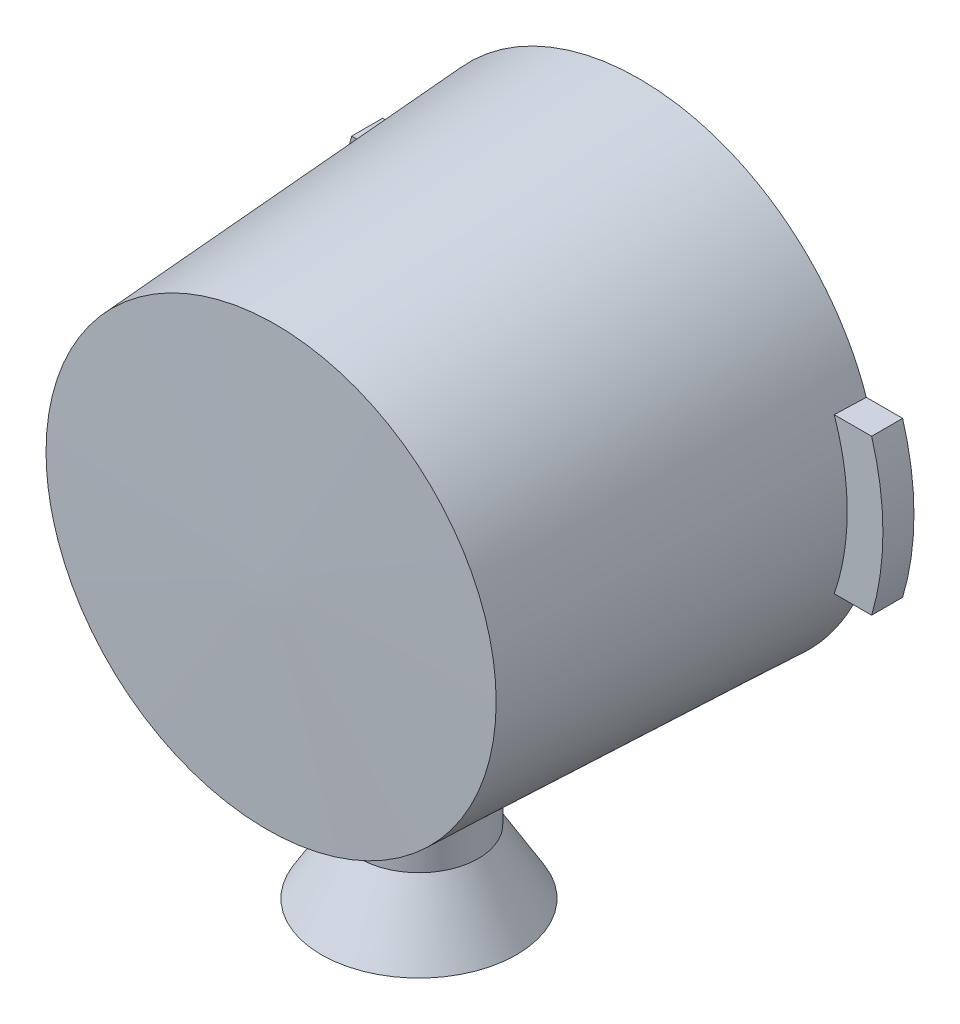
from build123d import *

# Parameters (mm, degrees)
BOSS_EXTRUDE9_DEPTH = 5
SKETCH10_W          = 100.017630752
SKETCH10_H          = 82.257490713
CUT_EXTRUDE5_DEPTH  = 5


with BuildPart() as part:
    # Sketch3 → Revolve4 (revolve)
    with BuildSketch(Plane.XY):
        Polygon((-45.345396491, 59.752657492), (-50.285549319, 51.471259135), (-37.687875269, 51.471259135), (-37.687875269, 71.31273478), (-45.345396491, 71.31273478), align=None)
    revolve(axis=Axis((-37.687875269, 51.471259135, 0), (0, 1, 0)))

    # Sketch5 → Revolve5 (revolve)
    with BuildSketch(Plane(origin=(0, 97.31273478, 0), x_dir=(1, 0, 0), z_dir=(0, 1, 0))):
        Polygon((-37.687875269, 0), (-37.302956611, -20), (-65.802956611, -20), (-69.265253256, 29.40337608), (-38.265253256, 30), align=None)
    revolve(axis=Axis((-37.687875269, 97.31273478, 0), (-0.01924236949216868, 0, -0.9998148484676185)))

    # Sketch9 → Boss-Extrude9 (add)
    with BuildSketch(Plane.XY.offset(-25)):
        with BuildLine():
            Line((-9.761081063, 87.31273478), (-4.286962272, 87.31273478))
            ThreePointArc((-4.286962272, 87.31273478), (-2.827981935, 97.31273478), (-4.286962272, 107.31273478))
            Line((-4.286962272, 107.31273478), (-9.761081063, 107.31273478))
            Line((-9.761081063, 107.31273478), (-9.761081063, 87.31273478))
        make_face()
        with BuildLine():
            ThreePointArc((-66.708431797, 87.31273478), (-68.390710613, 97.31273478), (-66.708431797, 107.31273478))
            Line((-66.708431797, 107.31273478), (-71.369001597, 107.31273478))
            ThreePointArc((-71.369001597, 107.31273478), (-72.827981935, 97.31273478), (-71.369001597, 87.31273478))
            Line((-71.369001597, 87.31273478), (-66.708431797, 87.31273478))
        make_face()
    extrude(amount=-BOSS_EXTRUDE9_DEPTH)

    # Sketch10 → Cut-Extrude5 (cut)
    with BuildSketch(Plane.XY.offset(-29.00378798)):
        with Locations((-35.882792004, 102.435950212)):
            Rectangle(SKETCH10_W, SKETCH10_H)
    extrude(amount=-CUT_EXTRUDE5_DEPTH, mode=Mode.SUBTRACT)

    # Sketch6 → Cut-Revolve4 (revolve, cut)
    with BuildSketch(Plane(origin=(0, 97.31273478, 0), x_dir=(1, 0, 0), z_dir=(0, 1, 0))):
        Polygon((-37.370304904, -16.50064803), (-62.508760096, -16.940904481), (-65.765253256, 30.531390366), (-38.285658965, 31.060260794), align=None)
    revolve(axis=Axis((-38.285658965, 97.31273478, -31.060260794), (0.019242369492168804, 0, 0.9998148484676185)), mode=Mode.SUBTRACT)


solid = part.part
